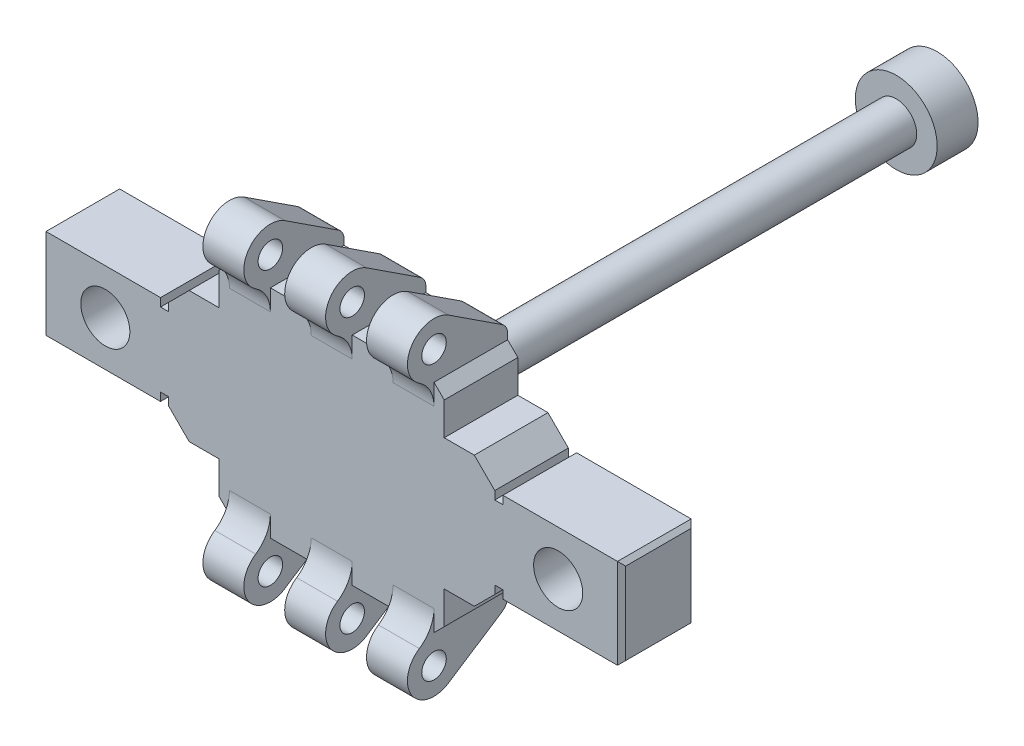
from build123d import *

# Parameters (mm, degrees)
SKETCH1_R               = 60
BOSS_EXTRUDE1_DEPTH     = 180
SKETCH3_R               = 30
BOSS_EXTRUDE2_DEPTH     = 50
CHAMFER5_SIZE           = 50
CHAMFER6_SIZE           = 10
FILLET1_R               = 30
FILLET2_R               = 80
LPATTERN4_START         = -250
LPATTERN4_OUTLINE_R     = 30
LPATTERN4_DEPTH         = 100
LPATTERN4_START_2       = 150
LPATTERN4_2_OUTLINE_R   = 30
LPATTERN4_2_DEPTH       = 100
MIRROR1_START           = -250
MIRROR1_OUTLINE_R       = 30
MIRROR1_DEPTH           = 100
MIRROR1_START_2         = -50
MIRROR1_2_OUTLINE_R     = 30
MIRROR1_2_DEPTH         = 100
MIRROR1_START_3         = 150
MIRROR1_3_OUTLINE_R     = 30
MIRROR1_3_DEPTH         = 100
SKETCH4_W               = 20
SKETCH4_H               = 20
CUT_EXTRUDE1_DEPTH      = 308
MIRROR3_COPY_1_SKETCH_W = 20
MIRROR3_COPY_1_SKETCH_H = 20
MIRROR3_COPY_1_DEPTH    = 308
CHAMFER7_SIZE           = 25
CHAMFER8_SIZE           = 25
SKETCH5_R               = 50
BOSS_EXTRUDE3_DEPTH     = 1200
SKETCH6_R               = 100
BOSS_EXTRUDE4_DEPTH     = 100


# Read off the part's stored shape, not the designer's step: LPattern4, Mirror1
# Some blends are built 0.0001 mm under size
with BuildPart() as part:
    # Sketch1 → Boss-Extrude1 (new body)
    with BuildSketch(Plane.XY):
        Polygon((398.5, 110), (708.5, 110), (708.5, -110), (398.5, -110), (398.5, -160), (275, -160), (275, -265), (-275, -265), (-275, -160), (-398.5, -160), (-398.5, -110), (-708.5, -110), (-708.5, 110), (-398.5, 110), (-398.5, 160), (-275, 160), (-275, 265), (275, 265), (275, 160), (398.5, 160), align=None)
        with Locations(Location((553.5, 0, 0), (0, 0, 180))):
            Circle(SKETCH1_R, mode=Mode.SUBTRACT)
        with Locations(Location((-553.5, 0, 0), (0, 0, 180))):
            Circle(SKETCH1_R, mode=Mode.SUBTRACT)
    extrude(amount=BOSS_EXTRUDE1_DEPTH)

    # Sketch3 → Boss-Extrude2 (add, symmetric)
    with BuildSketch(Plane.ZY):
        with BuildLine():
            Line((0, 295), (144.437021115, 389.408404983))
            ThreePointArc((144.437021115, 389.408404983), (237.667058368, 364.991838543), (204.124993391, 274.642857143))
            Line((204.124993391, 274.642857143), (180, 265))
            Line((180, 265), (0, 265))
            Line((0, 265), (0, 295))
        make_face()
        with Locations(Location((180, 335, 0), (0, 0, 270))):
            Circle(SKETCH3_R, mode=Mode.SUBTRACT)
    extrude(amount=BOSS_EXTRUDE2_DEPTH, both=True)

    # Chamfer5
    chamfer5_edges = [part.edges().sort_by_distance(p)[0] for p in [
        (-398.5, -160, 90),
        (-398.5, 160, 90),
        (398.5, -160, 90),
        (398.5, 160, 90),
    ]]
    chamfer(chamfer5_edges, length=CHAMFER5_SIZE - 0.0001)  # a hair under: the kernel refuses the full size

    # Chamfer6
    chamfer6_edges = [part.edges().sort_by_distance(p)[0] for p in [
        (-708.5, 0, 0),
        (708.5, 0, 0),
        (708.5, -110, 90),
        (-708.5, -110, 90),
        (-708.5, 110, 90),
        (708.5, 110, 90),
        (-708.5, 0, 180),
        (708.5, 0, 180),
    ]]
    chamfer(chamfer6_edges, length=CHAMFER6_SIZE)

    # Fillet1
    fillet1_edges = [part.edges().sort_by_distance(p)[0] for p in [
        (0, 295, 0),
    ]]
    fillet(fillet1_edges, radius=FILLET1_R)

    # Fillet2
    # the kernel refuses this fillet: 80 mm, written as the material it adds along each edge
    with BuildSketch(Plane(origin=(50, 265, 180), x_dir=(0, 0.40293010852781525, 0.9152307510359139), z_dir=(-1, 0, 0))) as fillet2_piece_1:
        with BuildLine():
            CenterArc((52.695671837, -78.85064932), FILLET2_R, 99.723894653, 56.514623377)
            Line((-20.522788246, -46.616240638), (-27.844634254, -43.39279977))
            Line((-27.844634254, -43.39279977), (-7.321846008, 3.223440868))
            Line((-7.321846008, 3.223440868), (0.275664529, 7.995249156))
            ThreePointArc((0.275664529, 7.995249156), (26.240997825, 7.100002336), (37.83243285, 7.885064932))
            Line((37.83243285, 7.885064932), (39.183636394, 0))
        make_face()
    extrude(amount=100)

    # LPattern4 outline → LPattern4 (add)
    with BuildSketch(Plane.YZ.offset(LPATTERN4_START)):
        with BuildLine():
            ThreePointArc((389.408404983, 144.437021115), (370.712659311, 234.310274948), (280.788266865, 215.862068966))
            ThreePointArc((280.788266865, 215.862068966), (251.940699894, 189.533573658), (214.066133776, 180))
            Line((214.066133776, 180), (265, 180))
            Line((265, 180), (265, 0))
            Line((265, 0), (278.768856416, 0))
            ThreePointArc((278.768856416, 0), (293.044526683, 3.614298599), (303.880427947, 13.586317438))
            Line((303.880427947, 13.586317438), (389.408404983, 144.437021115))
        make_face()
        with Locations((335, 180)):
            Circle(LPATTERN4_OUTLINE_R, mode=Mode.SUBTRACT)
    extrude(amount=LPATTERN4_DEPTH)

    # LPattern4 2 outline → LPattern4 2 (add)
    with BuildSketch(Plane.YZ.offset(LPATTERN4_START_2)):
        with BuildLine():
            ThreePointArc((389.408404983, 144.437021115), (370.712659311, 234.310274948), (280.788266865, 215.862068966))
            ThreePointArc((280.788266865, 215.862068966), (251.940699894, 189.533573658), (214.066133776, 180))
            Line((214.066133776, 180), (265, 180))
            Line((265, 180), (265, 0))
            Line((265, 0), (278.768856416, 0))
            ThreePointArc((278.768856416, 0), (293.044526683, 3.614298599), (303.880427947, 13.586317438))
            Line((303.880427947, 13.586317438), (389.408404983, 144.437021115))
        make_face()
        with Locations((335, 180)):
            Circle(LPATTERN4_2_OUTLINE_R, mode=Mode.SUBTRACT)
    extrude(amount=LPATTERN4_2_DEPTH)

    # Mirror1 outline → Mirror1 (add)
    with BuildSketch(Plane.YZ.offset(MIRROR1_START)):
        with BuildLine():
            ThreePointArc((-280.788266865, 215.862068966), (-370.712659311, 234.310274948), (-389.408404983, 144.437021115))
            Line((-389.408404983, 144.437021115), (-303.880427947, 13.586317438))
            ThreePointArc((-303.880427947, 13.586317438), (-293.044526683, 3.614298599), (-278.768856416, 0))
            Line((-278.768856416, 0), (-265, 0))
            Line((-265, 0), (-265, 180))
            Line((-265, 180), (-214.066133776, 180))
            ThreePointArc((-214.066133776, 180), (-251.940699894, 189.533573658), (-280.788266865, 215.862068966))
        make_face()
        with Locations((-335, 180)):
            Circle(MIRROR1_OUTLINE_R, mode=Mode.SUBTRACT)
    extrude(amount=MIRROR1_DEPTH)

    # Mirror1 2 outline → Mirror1 2 (add)
    with BuildSketch(Plane.YZ.offset(MIRROR1_START_2)):
        with BuildLine():
            ThreePointArc((-280.788266865, 215.862068966), (-370.712659311, 234.310274948), (-389.408404983, 144.437021115))
            Line((-389.408404983, 144.437021115), (-303.880427947, 13.586317438))
            ThreePointArc((-303.880427947, 13.586317438), (-293.044526683, 3.614298599), (-278.768856416, 0))
            Line((-278.768856416, 0), (-265, 0))
            Line((-265, 0), (-265, 180))
            Line((-265, 180), (-214.066133776, 180))
            ThreePointArc((-214.066133776, 180), (-251.940699894, 189.533573658), (-280.788266865, 215.862068966))
        make_face()
        with Locations((-335, 180)):
            Circle(MIRROR1_2_OUTLINE_R, mode=Mode.SUBTRACT)
    extrude(amount=MIRROR1_2_DEPTH)

    # Mirror1 3 outline → Mirror1 3 (add)
    with BuildSketch(Plane.YZ.offset(MIRROR1_START_3)):
        with BuildLine():
            ThreePointArc((-280.788266865, 215.862068966), (-370.712659311, 234.310274948), (-389.408404983, 144.437021115))
            Line((-389.408404983, 144.437021115), (-303.880427947, 13.586317438))
            ThreePointArc((-303.880427947, 13.586317438), (-293.044526683, 3.614298599), (-278.768856416, 0))
            Line((-278.768856416, 0), (-265, 0))
            Line((-265, 0), (-265, 180))
            Line((-265, 180), (-214.066133776, 180))
            ThreePointArc((-214.066133776, 180), (-251.940699894, 189.533573658), (-280.788266865, 215.862068966))
        make_face()
        with Locations((-335, 180)):
            Circle(MIRROR1_3_OUTLINE_R, mode=Mode.SUBTRACT)
    extrude(amount=MIRROR1_3_DEPTH)

    # Sketch4 → Cut-Extrude1 (cut)
    with BuildSketch(Plane.XY.offset(180)):
        with Locations((-408.5, 100)):
            Rectangle(SKETCH4_W, SKETCH4_H)
    cut_extrude1 = extrude(amount=-CUT_EXTRUDE1_DEPTH, mode=Mode.SUBTRACT)

    # Mirror2: Cut-Extrude1 across plane
    add(cut_extrude1.mirror(Plane.ZX), mode=Mode.SUBTRACT)

    # Mirror3: Cut-Extrude1 across plane
    add(cut_extrude1.mirror(Plane.ZY), mode=Mode.SUBTRACT)

    # Mirror3 copy 1 sketch → Mirror3 copy 1 (cut)
    with BuildSketch(Plane(origin=(0, 0, 180), x_dir=(-1, 0, 0), z_dir=(0, 0, 1))):
        with Locations((-408.5, 100)):
            Rectangle(MIRROR3_COPY_1_SKETCH_W, MIRROR3_COPY_1_SKETCH_H)
    extrude(amount=-MIRROR3_COPY_1_DEPTH, mode=Mode.SUBTRACT)

    # Chamfer7
    chamfer7_edges = [part.edges().sort_by_distance(p)[0] for p in [
        (275, 265, 90),
        (-275, 265, 90),
    ]]
    chamfer(chamfer7_edges, length=CHAMFER7_SIZE - 0.0001)  # a hair under: the kernel refuses the full size

    # Chamfer8
    chamfer8_edges = [part.edges().sort_by_distance(p)[0] for p in [
        (-275, -265, 90),
        (275, -265, 90),
    ]]
    chamfer(chamfer8_edges, length=CHAMFER8_SIZE - 0.0001)  # a hair under: the kernel refuses the full size


with BuildPart() as body_2:
    # Sketch5 → Boss-Extrude3 (new body)
    with BuildSketch(Plane(origin=(0, 0, 0), x_dir=(-1, 0, 0), z_dir=(0, 0, -1))):
        Circle(SKETCH5_R)
    extrude(amount=BOSS_EXTRUDE3_DEPTH)

    # Sketch6 → Boss-Extrude4 (add)
    with BuildSketch(Plane(origin=(0, 0, -1200), x_dir=(-1, 0, 0), z_dir=(0, 0, -1))):
        Circle(SKETCH6_R)
    extrude(amount=BOSS_EXTRUDE4_DEPTH)


solid = Compound([part.part, body_2.part])
